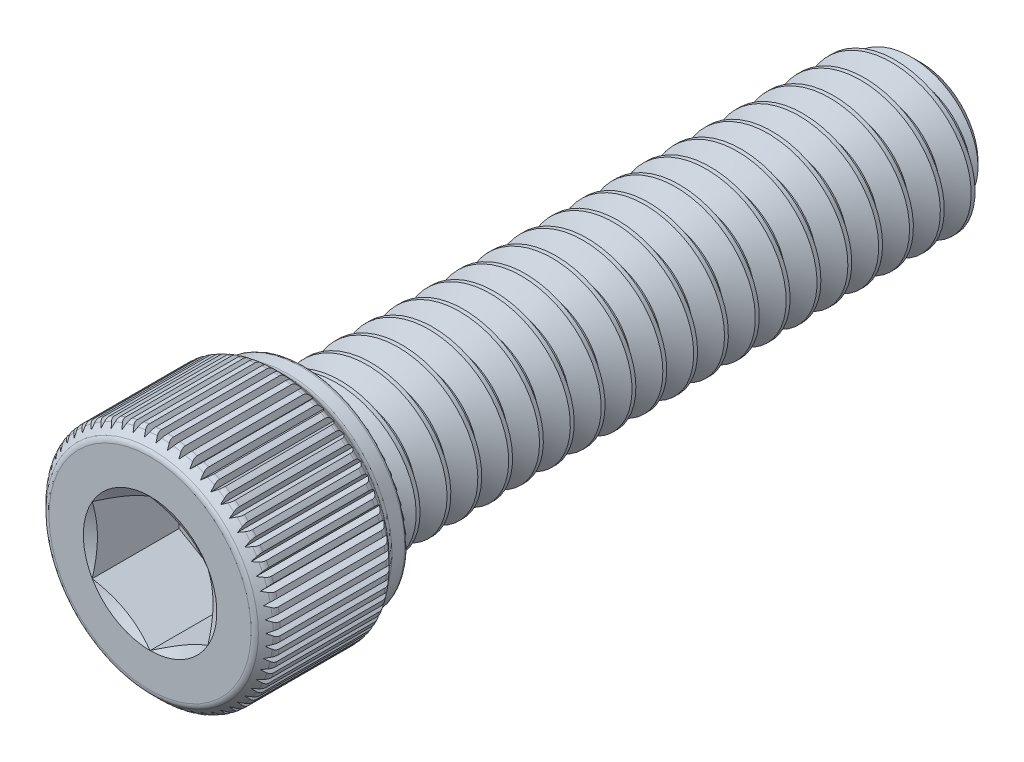
from build123d import *

# Parameters (mm, degrees)
CUT_EXTRUDE1_DEPTH = 3.571875
CUT_SWEEP1_PITCH   = 1.27
CUT_EXTRUDE3_START = -5.318125
CUT_EXTRUDE3_DEPTH = 5.08
CIRPATTERN1_COUNT  = 60


with BuildPart() as part:
    # Sketch2 → Revolve1 (revolve)
    with BuildSketch(Plane(origin=(0, 0, 0), x_dir=(0, 0, -1), z_dir=(1, 0, 0))):
        with BuildLine():
            Line((15.875, 2.350110803), (15.050110803, 3.175))
            Line((15.050110803, 3.175), (-9.525, 3.175))
            Line((-9.525, 3.175), (-9.525, 4.137421875))
            ThreePointArc((-9.525, 4.137421875), (-9.568590749, 4.242659251), (-9.673828125, 4.28625))
            Line((-9.673828125, 4.28625), (-10.195456744, 4.28625))
            ThreePointArc((-10.195456744, 4.28625), (-10.30936486, 4.308907733), (-10.405931497, 4.373431497))
            Line((-10.405931497, 4.373431497), (-10.707818503, 4.675318503))
            ThreePointArc((-10.707818503, 4.675318503), (-10.80438514, 4.739842267), (-10.918293256, 4.7625))
            Line((-10.918293256, 4.7625), (-15.275456744, 4.7625))
            ThreePointArc((-15.275456744, 4.7625), (-15.38936486, 4.739842267), (-15.485931497, 4.675318503))
            Line((-15.485931497, 4.675318503), (-15.787818503, 4.373431497))
            ThreePointArc((-15.787818503, 4.373431497), (-15.852342267, 4.27686486), (-15.875, 4.162956744))
            Line((-15.875, 4.162956744), (-15.875, 0))
            Line((-15.875, 0), (15.875, 0))
            Line((15.875, 0), (15.875, 2.350110803))
        make_face()
    revolve(axis=Axis((0, 0, -15.875), (0, 0, 1)))

    # Sketch4 → Cut-Extrude1 (cut)
    with BuildSketch(Plane.XY.offset(15.875)):
        Polygon((0, 2.749630657), (-2.38125, 1.374815329), (-2.38125, -1.374815329), (0, -2.749630657), (2.38125, -1.374815329), (2.38125, 1.374815329), align=None)
    extrude(amount=-CUT_EXTRUDE1_DEPTH, mode=Mode.SUBTRACT)

    # Cut-Extrude2: read off the stored shape, not the designer's step
    # Cut-Extrude2: loft between two sections, ruled curve by curve
    cut_extrude2_from = [
        Edge.make_three_point_arc((4e-09, 2.380971631, 15.662154612), (-1.190485814, 2.061981919, 15.662154612), (-2.061981918, 1.190485816, 15.662154612)),
        Edge.make_line((-2.061981918, 1.190485816, 15.662154612), (4e-09, 2.380971631, 15.662154612)),
    ]
    cut_extrude2_to = [
        Edge.make_three_point_arc((4e-09, 2.749630657, 15.875), (-1.374815327, 2.381250001, 15.875), (-2.38125, 1.374815329, 15.875)),
        Edge.make_line((-2.38125, 1.374815329, 15.875), (4e-09, 2.749630657, 15.875)),
    ]
    cut_extrude2 = Solid(Shell([*[Face.make_surface_from_curves(cut_extrude2_from[k], cut_extrude2_to[k]) for k in range(2)], Face(Wire(cut_extrude2_from)), Face(Wire(cut_extrude2_to))]))
    add(cut_extrude2, mode=Mode.SUBTRACT)

    # Cut-Extrude2 2: loft between two sections, ruled curve by curve
    cut_extrude2_2_from = [
        Edge.make_three_point_arc((-2.061980129, 1.190485048, 15.662153496), (-2.380969698, 1.7e-08, 15.662153496), (-2.061980146, -1.190485019, 15.662153496)),
        Edge.make_line((-2.061980146, -1.190485019, 15.662153496), (-2.061980129, 1.190485048, 15.662153496)),
    ]
    cut_extrude2_2_to = [
        Edge.make_three_point_arc((-2.381249867, 1.374815558, 15.875), (-2.749630657, 1.9e-08, 15.875), (-2.381249887, -1.374815525, 15.875)),
        Edge.make_line((-2.381249887, -1.374815525, 15.875), (-2.381249867, 1.374815558, 15.875)),
    ]
    cut_extrude2_2 = Solid(Shell([*[Face.make_surface_from_curves(cut_extrude2_2_from[k], cut_extrude2_2_to[k]) for k in range(2)], Face(Wire(cut_extrude2_2_from)), Face(Wire(cut_extrude2_2_to))]))
    add(cut_extrude2_2, mode=Mode.SUBTRACT)

    # Cut-Extrude2 3: loft between two sections, ruled curve by curve
    cut_extrude2_3_from = [
        Edge.make_three_point_arc((-2.06198192, -1.190485812, 15.662154612), (-1.190485817, -2.061981917, 15.662154612), (0, -2.380971631, 15.662154612)),
        Edge.make_line((0, -2.380971631, 15.662154612), (-2.06198192, -1.190485812, 15.662154612)),
    ]
    cut_extrude2_3_to = [
        Edge.make_three_point_arc((-2.381250003, -1.374815325, 15.875), (-1.374815331, -2.381249999, 15.875), (0, -2.749630657, 15.875)),
        Edge.make_line((0, -2.749630657, 15.875), (-2.381250003, -1.374815325, 15.875)),
    ]
    cut_extrude2_3 = Solid(Shell([*[Face.make_surface_from_curves(cut_extrude2_3_from[k], cut_extrude2_3_to[k]) for k in range(2)], Face(Wire(cut_extrude2_3_from)), Face(Wire(cut_extrude2_3_to))]))
    add(cut_extrude2_3, mode=Mode.SUBTRACT)

    # Cut-Extrude2 4: loft between two sections, ruled curve by curve
    cut_extrude2_4_from = [
        Edge.make_three_point_arc((-4e-09, -2.380971631, 15.662154612), (1.190485814, -2.061981919, 15.662154612), (2.061981918, -1.190485816, 15.662154612)),
        Edge.make_line((2.061981918, -1.190485816, 15.662154612), (-4e-09, -2.380971631, 15.662154612)),
    ]
    cut_extrude2_4_to = [
        Edge.make_three_point_arc((-4e-09, -2.749630657, 15.875), (1.374815327, -2.381250001, 15.875), (2.38125, -1.374815329, 15.875)),
        Edge.make_line((2.38125, -1.374815329, 15.875), (-4e-09, -2.749630657, 15.875)),
    ]
    cut_extrude2_4 = Solid(Shell([*[Face.make_surface_from_curves(cut_extrude2_4_from[k], cut_extrude2_4_to[k]) for k in range(2)], Face(Wire(cut_extrude2_4_from)), Face(Wire(cut_extrude2_4_to))]))
    add(cut_extrude2_4, mode=Mode.SUBTRACT)

    # Cut-Extrude2 5: loft between two sections, ruled curve by curve
    cut_extrude2_5_from = [
        Edge.make_three_point_arc((2.061980146, -1.190485019, 15.662153496), (2.380969698, 1.7e-08, 15.662153496), (2.061980129, 1.190485048, 15.662153496)),
        Edge.make_line((2.061980129, 1.190485048, 15.662153496), (2.061980146, -1.190485019, 15.662153496)),
    ]
    cut_extrude2_5_to = [
        Edge.make_three_point_arc((2.381249887, -1.374815525, 15.875), (2.749630657, 1.9e-08, 15.875), (2.381249867, 1.374815558, 15.875)),
        Edge.make_line((2.381249867, 1.374815558, 15.875), (2.381249887, -1.374815525, 15.875)),
    ]
    cut_extrude2_5 = Solid(Shell([*[Face.make_surface_from_curves(cut_extrude2_5_from[k], cut_extrude2_5_to[k]) for k in range(2)], Face(Wire(cut_extrude2_5_from)), Face(Wire(cut_extrude2_5_to))]))
    add(cut_extrude2_5, mode=Mode.SUBTRACT)

    # Cut-Extrude2 6: loft between two sections, ruled curve by curve
    cut_extrude2_6_from = [
        Edge.make_three_point_arc((2.06198192, 1.190485812, 15.662154612), (1.190485817, 2.061981917, 15.662154612), (0, 2.380971631, 15.662154612)),
        Edge.make_line((0, 2.380971631, 15.662154612), (2.06198192, 1.190485812, 15.662154612)),
    ]
    cut_extrude2_6_to = [
        Edge.make_three_point_arc((2.381250003, 1.374815325, 15.875), (1.374815331, 2.381249999, 15.875), (0, 2.749630657, 15.875)),
        Edge.make_line((0, 2.749630657, 15.875), (2.381250003, 1.374815325, 15.875)),
    ]
    cut_extrude2_6 = Solid(Shell([*[Face.make_surface_from_curves(cut_extrude2_6_from[k], cut_extrude2_6_to[k]) for k in range(2)], Face(Wire(cut_extrude2_6_from)), Face(Wire(cut_extrude2_6_to))]))
    add(cut_extrude2_6, mode=Mode.SUBTRACT)

    # Cut-Sweep1: arcs per turn and ends read off the stored shape
    # Cut-Sweep1: the profile of Sketch7 profile screwed along a right-hand helix through 20.25 turns, 8 arcs to a turn; built about Z, then put on its axis
    cut_sweep1_z = Axis((0, 0, 0), (0, 0, 1))
    cut_sweep1_corners = [(3.1753, 0, 0.000173205), (3.1753, 0, -1.111423205), (2.350110803, 0, -0.635), (2.350110803, 0, -0.47625)]
    with BuildLine(mode=Mode.PRIVATE) as cut_sweep1_profile:
        Line(cut_sweep1_corners[0], cut_sweep1_corners[1])
        Line(cut_sweep1_corners[1], cut_sweep1_corners[2])
        Line(cut_sweep1_corners[2], cut_sweep1_corners[3])
        Line(cut_sweep1_corners[3], cut_sweep1_corners[0])
    cut_sweep1_cap = Face(cut_sweep1_profile.wire())
    cut_sweep1_turn_angles = [0, 22.5, 45, 67.5, 90, 112.5, 135, 157.5, 180, 202.5, 225, 247.5, 270, 292.5, 315, 337.5, 360]
    cut_sweep1_turn_weights = [1, 0.9238795325112867, 1, 0.9238795325112867, 1, 0.9238795325112867, 1, 0.9238795325112867, 1, 0.9238795325112867, 1, 0.9238795325112867, 1, 0.9238795325112867, 1, 0.9238795325112867, 1]
    cut_sweep1_turn_rails = [Edge.make_bspline([Vector(p[0], p[1], 0).rotate(cut_sweep1_z, cut_sweep1_turn_angles[k]) / cut_sweep1_turn_weights[k] + Vector(0, 0, p[2] + CUT_SWEEP1_PITCH * cut_sweep1_turn_angles[k] / 360) for k in range(17)], [0, 0, 0, 1, 1, 2, 2, 3, 3, 4, 4, 5, 5, 6, 6, 7, 7, 8, 8, 8], 2, cut_sweep1_turn_weights) for p in cut_sweep1_corners]
    cut_sweep1_turn_sides = [Face.make_surface_from_curves(cut_sweep1_turn_rails[p[0]], cut_sweep1_turn_rails[p[1]]) for p in [(0, 1), (1, 2), (2, 3), (3, 0)]]
    cut_sweep1_last_angles = [7200, 7222.5, 7245, 7267.5, 7290]
    cut_sweep1_last_weights = [1, 0.9238795325112867, 1, 0.9238795325112837, 1]
    cut_sweep1_last_rails = [Edge.make_bspline([Vector(p[0], p[1], 0).rotate(cut_sweep1_z, cut_sweep1_last_angles[k]) / cut_sweep1_last_weights[k] + Vector(0, 0, p[2] + CUT_SWEEP1_PITCH * cut_sweep1_last_angles[k] / 360) for k in range(5)], [0, 0, 0, 1, 1, 2, 2, 2], 2, cut_sweep1_last_weights) for p in cut_sweep1_corners]
    cut_sweep1_last_sides = [Face.make_surface_from_curves(cut_sweep1_last_rails[p[0]], cut_sweep1_last_rails[p[1]]) for p in [(0, 1), (1, 2), (2, 3), (3, 0)]]
    cut_sweep1 = Plane(origin=(0, 0, -15.875), x_dir=(0, 1, 0), z_dir=(0, 0, 1)) * Solid(Shell([*[p.moved(Location((0, 0, CUT_SWEEP1_PITCH * i))) for i in range(20) for p in cut_sweep1_turn_sides], *cut_sweep1_last_sides, cut_sweep1_cap, cut_sweep1_cap.rotate(cut_sweep1_z, 7290).moved(Location((0, 0, CUT_SWEEP1_PITCH * 7290 / 360)))]))
    add(cut_sweep1, mode=Mode.SUBTRACT)

    # Sketch8 → Revolve2 (revolve)
    with BuildSketch(Plane(origin=(0, 0, 0), x_dir=(0, 0, -1), z_dir=(1, 0, 0))):
        Polygon((-10.918293256, 0), (-10.918293256, 3.243740766), (-8.89, 3.243740766), (-7.017225395, 0), align=None)
    revolve(axis=Axis((0, 0, 7.017225395), (0, 0, 1)))

    # Sketch6 → Cut-Extrude3 (cut)
    with BuildSketch(Plane.XY.offset(15.875).offset(CUT_EXTRUDE3_START)):
        Polygon((-0.229135888, 4.92125), (0, 4.524375), (0.229135888, 4.92125), align=None)
    cut_extrude3 = extrude(amount=CUT_EXTRUDE3_DEPTH, mode=Mode.SUBTRACT)

    # CirPattern1: Cut-Extrude3 ×60 about axis
    cirpattern1_axis = Axis((0, 0, 0), (0, 0, 1))
    for i in range(1, CIRPATTERN1_COUNT):
        add(cut_extrude3.rotate(cirpattern1_axis, i * 360 / CIRPATTERN1_COUNT), mode=Mode.SUBTRACT)


solid = part.part
